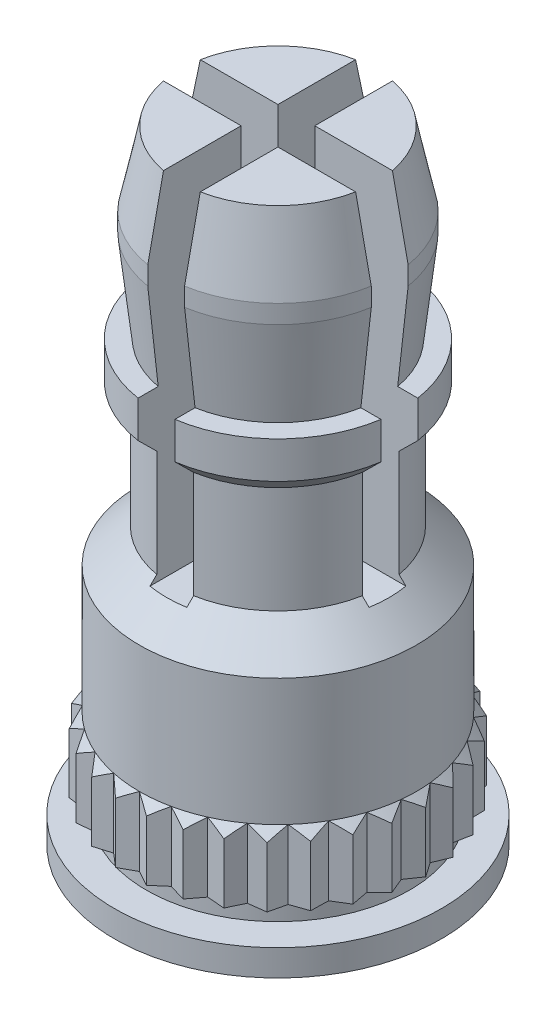
from build123d import *

# Parameters (mm, degrees)
SLITCUTSKE_W       = 5.33220965
SLITCUTSKE_H       = 0.7155
SLITCUT_DEPTH      = 6.8582
SLITCUTPAT_COUNT   = 2
SLITCUTPAT_ANGLE   = 90
CLINCHCUT_START    = -1.345
CLINCHCUT_DEPTH    = 1.345
CLINCHCUTPAT_COUNT = 30
CLINCHCUTPAT_ANGLE = 348


with BuildPart() as part:
    # BodySke → Body (revolve)
    with BuildSketch(Plane.XY):
        Polygon((2.5555, 0), (2.5555, 0.3825), (2.87, 0.3825), (2.87, 1.5475), (2.69, 1.7275), (2.69, 4.18905), (2.02725, 4.8518), (2.02725, 6.92675), (2.385, 7.2845), (2.385, 8), (2, 8), (2.2, 9.79), (2.2, 10.148), (1.9, 11.58), (0, 11.58), (0, -0.51), (3.175, -0.51), (3.175, 0), align=None)
    revolve(axis=Axis((0, -0.51, 0), (0, 1, 0)))

    # SlitCutSke → SlitCut (cut)
    with BuildSketch(Plane(origin=(0, 11.58, 0), x_dir=(-1, 0, 0), z_dir=(0, 1, 0))):
        Rectangle(SLITCUTSKE_W, SLITCUTSKE_H)
    slitcut = extrude(amount=-SLITCUT_DEPTH, mode=Mode.SUBTRACT)

    # SlitCutPat: SlitCut ×2 about axis
    slitcutpat_axis = Axis((0, -0.51, 0), (0, 1, 0))
    for i in range(1, SLITCUTPAT_COUNT):
        add(slitcut.rotate(slitcutpat_axis, i * SLITCUTPAT_ANGLE / (SLITCUTPAT_COUNT - 1)), mode=Mode.SUBTRACT)

    # CliRinCutSke → ClinchCut (cut)
    with BuildSketch(Plane.XZ.offset(-0.3825).offset(CLINCHCUT_START)):
        with BuildLine():
            Line((0.29999669, 2.85427784), (0, 2.69))
            Line((0, 2.69), (-0.29999669, 2.85427784))
            ThreePointArc((-0.29999669, 2.85427784), (0, 2.87), (0.29999669, 2.85427784))
        make_face()
    clinchcut = extrude(amount=CLINCHCUT_DEPTH, mode=Mode.SUBTRACT)

    # ClinchCutPat: ClinchCut ×30 about axis
    clinchcutpat_axis = Axis((0, -0.51, 0), (0, 1, 0))
    for i in range(1, CLINCHCUTPAT_COUNT):
        add(clinchcut.rotate(clinchcutpat_axis, i * CLINCHCUTPAT_ANGLE / (CLINCHCUTPAT_COUNT - 1)), mode=Mode.SUBTRACT)


solid = part.part
